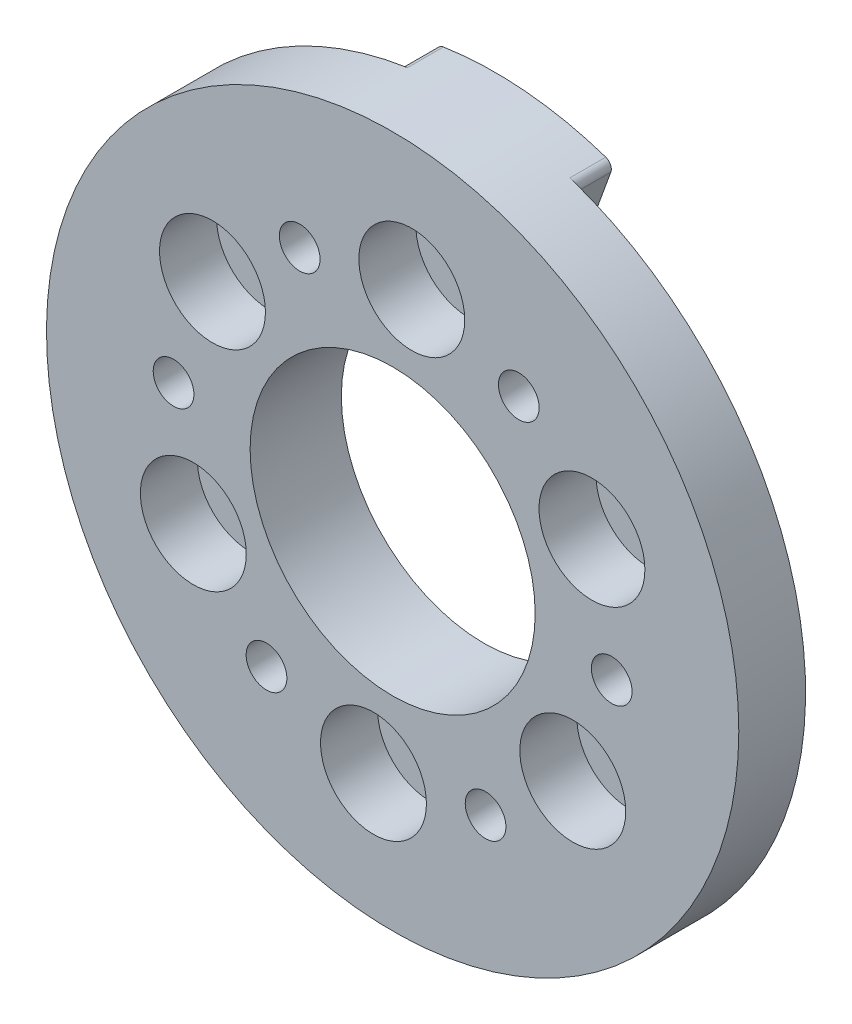
from build123d import *

# Parameters (mm, degrees)
SKETCH_1_W                    = 3.75
SKETCH_1_H                    = 0.7
REVOLVE_1_ANGLE               = 30
EXTRUDE_1_DEPTH               = 1.5
EXTRUDE_START                 = -4.1
SKETCH_3_R                    = 21.25
EXTRUDE_2_DEPTH               = 4.1
HOLE_WIZARD_2_5_2_5_1_D       = 2.5
HOLE_WIZARD_17_5_17_5_1_D     = 17.5
HOLE_WIZARD_17_5_17_5_1_DEPTH = 6.3
HOLE_WIZARD_M3_1_D            = 3.4
HOLE_WIZARD_M3_1_DEPTH        = 6.3
HOLE_WIZARD_M3_1_CBORE_D      = 6.5
HOLE_WIZARD_M3_1_CBORE_DEPTH  = 3.5
FILLET_1_R                    = 0.5
FILLET_2_R                    = 1


with BuildPart() as part:
    # 草图1 → 旋转1 (revolve)
    with BuildSketch(Plane(origin=(0, 0, 0), x_dir=(0.34202014332566955, 0.9396926207859082, 0), z_dir=(0.9396926207859082, -0.34202014332566955, 0))):
        with Locations((19.375, -0.35)):
            Rectangle(SKETCH_1_W, SKETCH_1_H)
    revolve(axis=Axis((0, 0, 0), (0, 0, 1)), revolution_arc=REVOLVE_1_ANGLE)

    # 草图2 → 凸台-拉伸1 (add)
    with BuildSketch(Plane.XY):
        with BuildLine():
            Line((-3.038843109, 17.234135678), (-3.690023775, 20.927164752))
            ThreePointArc((-3.690023775, 20.927164752), (1.852059533, 21.169137334), (7.267928046, 19.968468192))
            Line((7.267928046, 19.968468192), (5.985352508, 16.444620864))
            ThreePointArc((5.985352508, 16.444620864), (6.73975713, 14.511225787), (8.703707451, 15.18207748))
            ThreePointArc((8.703707451, 15.18207748), (-1.525225498, -17.433407217), (-5.93513849, 16.462810547))
            ThreePointArc((-5.93513849, 16.462810547), (-4.117517161, 15.461114204), (-3.038843109, 17.234135678))
        make_face()
    extrude(amount=EXTRUDE_1_DEPTH)

    # 草图3 → 凸台-拉伸2 (add)
    with BuildSketch(Plane(origin=(0, 0, 1.5), x_dir=(-1, 0, 0), z_dir=(0, 0, -1)).offset(EXTRUDE_START)):
        with Locations(Location((0, 0, 0), (0, 0, 80))):
            Circle(SKETCH_3_R)
    extrude(amount=EXTRUDE_2_DEPTH)

    # Ø2.5 (2.5) 直径孔1 (through all)
    with Locations(Plane(origin=(0, 0, 0), x_dir=(-1, 0, 0), z_dir=(0, 0, -1))):
        with Locations((13.448628424, 1.176602527), (7.743281891, -11.058552598), (-5.705346534, -12.235155125), (-13.448628424, -1.176602527), (-7.743281891, 11.058552598), (5.705346533, 12.235155125)):
            Hole(HOLE_WIZARD_2_5_2_5_1_D / 2)

    # Ø17.5 (17.5) 直径孔1
    with Locations(Plane.XY.offset(5.6)):
        with Locations((0, 0)):
            Hole(HOLE_WIZARD_17_5_17_5_1_D / 2, depth=HOLE_WIZARD_17_5_17_5_1_DEPTH)

    # M3 六角头机械螺钉的柱形沉头孔1
    with Locations(Plane.XY.offset(5.6)):
        with Locations((12.235155125, 5.705346533), (1.176602527, 13.448628424), (-11.058552598, 7.743281891), (-12.235155125, -5.705346533), (-1.176602527, -13.448628424), (11.058552598, -7.743281891)):
            CounterBoreHole(HOLE_WIZARD_M3_1_D / 2, HOLE_WIZARD_M3_1_CBORE_D / 2, HOLE_WIZARD_M3_1_CBORE_DEPTH, depth=HOLE_WIZARD_M3_1_DEPTH)

    # 圆角1
    # the kernel refuses this fillet: 0.5 mm, written as the material it takes off along each edge
    with BuildSketch(Plane(origin=(-3.038843109, 17.234135678, 0), x_dir=(-0.17364817766693064, 0.984807753012208, -5.075305255429288e-15), z_dir=(0, 0, -1))) as fillet_1_piece_1:
        with BuildLine():
            CenterArc((0.493054215, 0.5), FILLET_1_R, 181.591754177, 88.408245823)
            ThreePointArc((-0.006752846, 0.486111111), (-0.001688293, 0.243079006), (0, 0))
            Line((0, 0), (0.493054215, 0))
        make_face()
    extrude(amount=1.932635539, mode=Mode.SUBTRACT)
    with BuildSketch(Plane(origin=(5.985352508, 16.444620864, 0), x_dir=(0.34202014332566866, 0.9396926207859084, -5.075305255429287e-15), z_dir=(0, 0, -1))) as fillet_1_piece_2:
        with BuildLine():
            CenterArc((0.493054215, -0.5), FILLET_1_R, 90, 88.408245823)
            ThreePointArc((-0.006752846, -0.486111111), (-0.001688293, -0.243079006), (0, 0))
            Line((0, 0), (0.493054215, 0))
        make_face()
    extrude(amount=1.932635539, mode=Mode.SUBTRACT)
    with BuildSketch(Plane(origin=(7.267928046, 19.968468192, 1.5), x_dir=(-0.943745429784676, 0.33067289541257716, 0), z_dir=(0, 0, -1)), Plane(origin=(-3.690023775, 20.927164752, -1.980213416), x_dir=(0.9868285618140304, 0.1617695570496889, 5.378398972447093e-15), z_dir=(0, 0, 1))) as fillet_1_piece_3:
        with BuildLine():
            CenterArc((0.506060833, -0.499963704), FILLET_1_R, 89.309622583, 91.380754834)
            Line((0.006097129, -0.505988237), (0, 0))
            ThreePointArc((0, 0), (0.256042683, 0.001542594), (0.512085366, 0))
        make_face()
    extrude(amount=3.480213416, mode=Mode.SUBTRACT)
    with BuildSketch(Plane(origin=(5.985352508, 16.444620864, 0), x_dir=(0.3420201433260408, 0.9396926207857731, 0), z_dir=(0, 0, 1))) as fillet_1_piece_4:
        with BuildLine():
            CenterArc((0.009949299, 0.5), FILLET_1_R, 267.872834894, 2.127165106)
            ThreePointArc((-0.008609454, 0.000344546), (-0.00430448, 0.000178455), (0, 0))
            Line((0, 0), (0.009949299, 0))
        make_face()
    extrude(amount=1.5, mode=Mode.SUBTRACT)
    with BuildSketch(Plane(origin=(-3.038843109, 17.234135678, 0), x_dir=(-0.17364817766558338, 0.9848077530124456, 0), z_dir=(0, 0, 1))) as fillet_1_piece_5:
        with BuildLine():
            CenterArc((0.009949299, -0.5), FILLET_1_R, 90, 2.127165106)
            ThreePointArc((-0.008609454, -0.000344546), (-0.00430448, -0.000178455), (0, 0))
            Line((0, 0), (0.009949299, 0))
        make_face()
    extrude(amount=1.5, mode=Mode.SUBTRACT)

    # 圆角2
    fillet_2_edges = [part.edges().sort_by_distance(p)[0] for p in [
        (-5.93513849, 16.462810547, 0.75),
        (8.703707451, 15.18207748, 0.75),
    ]]
    fillet(fillet_2_edges, radius=FILLET_2_R)


solid = part.part
